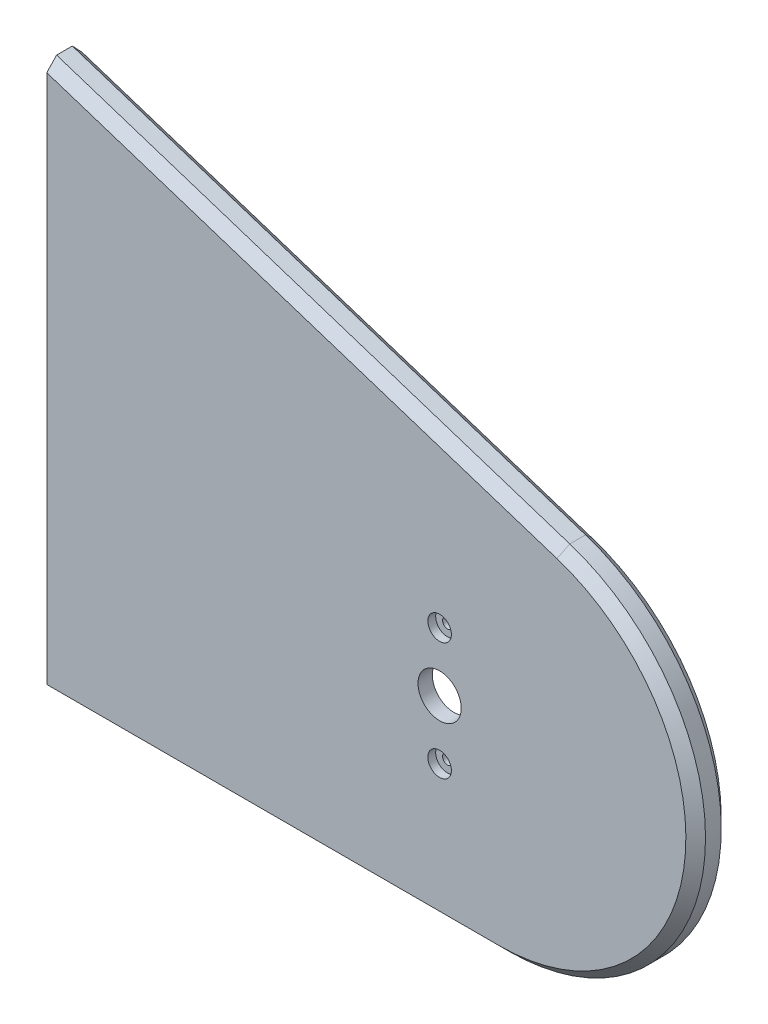
from build123d import *

# Parameters (mm, degrees)
SKETCH_1_R          = 11
EXTRUDE_1_DEPTH     = 8
FILLET_1_R          = 100
EXTRUDE_2_DEPTH     = 10
FILLET_2_R          = 10
CHAMFER_1_SIZE      = 5
SKETCH_4_R          = 13
CUT_EXTRUDE_1_DEPTH = 0.7
SKETCH_5_R          = 2.5
CUT_EXTRUDE_2_DEPTH = 434.184093957
SKETCH_6_R          = 6
CUT_EXTRUDE_3_DEPTH = 4


with BuildPart() as part:
    # 草图1 → 凸台-拉伸1 (new body)
    with BuildSketch(Plane.XY):
        Polygon((0, 0), (0, 280), (861.751390409, 0), align=None)
        with Locations((200, 100)):
            Circle(SKETCH_1_R, mode=Mode.SUBTRACT)
    extrude(amount=EXTRUDE_1_DEPTH)

    # 圆角1
    fillet_1_edges = [part.edges().sort_by_distance(p)[0] for p in [
        (861.751390409, 0, 4),
    ]]
    fillet(fillet_1_edges, radius=FILLET_1_R)

    # 草图2 → 凸台-拉伸2 (add)
    with BuildSketch(Plane.XY):
        with BuildLine():
            Line((0, 280), (0, 0))
            Line((0, 0), (230.376238942, 0))
            ThreePointArc((230.376238942, 0), (329.145073001, 84.356553496), (261.277938379, 195.10565163))
            Line((261.277938379, 195.10565163), (0, 280))
        make_face()
        with BuildLine():
            Line((230.376238942, 10), (30, 10))
            Line((30, 10), (151.410485182, 220.289128906))
            Line((151.410485182, 220.289128906), (258.187768435, 185.595086467))
            ThreePointArc((258.187768435, 185.595086467), (319.268189595, 85.920898146), (230.376238942, 10))
        make_face(mode=Mode.SUBTRACT)
        Polygon((10, 35.358983849), (10, 266.236180795), (122.241374643, 229.766747442), align=None, mode=Mode.SUBTRACT)
    extrude(amount=-EXTRUDE_2_DEPTH)

    # 圆角2
    fillet_2_edges = [part.edges().sort_by_distance(p)[0] for p in [
        (10, 35.358983849, -5),
        (30, 10, -5),
        (122.241374643, 229.766747442, -5),
        (151.410485182, 220.289128906, -5),
        (10, 266.236180795, -5),
    ]]
    fillet(fillet_2_edges, radius=FILLET_2_R)

    # 倒角1
    chamfer_1_edges = [part.edges().sort_by_distance(p)[0] for p in [
        (115.188119471, 0, 8),
        (130.63896919, 237.552825815, 8),
        (329.145073001, 84.356553496, 8),
        (130.63896919, 237.552825815, -10),
        (115.188119471, 0, -10),
        (329.145073001, 84.356553496, -10),
    ]]
    chamfer(chamfer_1_edges, length=CHAMFER_1_SIZE)

    # 草图4 → 切除-拉伸1 (cut)
    with BuildSketch(Plane(origin=(0, 0, 0), x_dir=(-1, 0, 0), z_dir=(0, 0, -1))):
        with Locations((-200, 100)):
            Circle(SKETCH_4_R)
    extrude(amount=-CUT_EXTRUDE_1_DEPTH, mode=Mode.SUBTRACT)

    # 草图5 → 切除-拉伸2 (cut, through all)
    with BuildSketch(Plane(origin=(0, 0, 0), x_dir=(-1, 0, 0), z_dir=(0, 0, -1))):
        with Locations((-200, 130)):
            Circle(SKETCH_5_R)
        with Locations((-200, 70)):
            Circle(SKETCH_5_R)
    extrude(amount=-CUT_EXTRUDE_2_DEPTH, mode=Mode.SUBTRACT)

    # 草图6 → 切除-拉伸3 (cut)
    with BuildSketch(Plane.XY.offset(8)):
        with Locations((200, 130)):
            Circle(SKETCH_6_R)
        with Locations((200, 70)):
            Circle(SKETCH_6_R)
    extrude(amount=-CUT_EXTRUDE_3_DEPTH, mode=Mode.SUBTRACT)


solid = part.part
